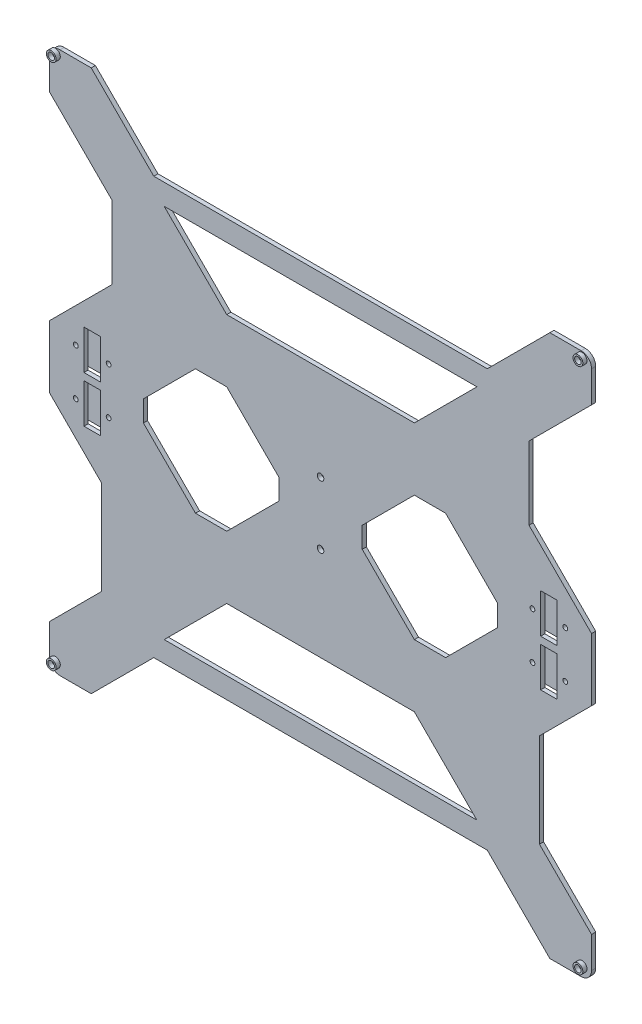
from build123d import *

# Parameters (mm, degrees)
MODEL_R             = 1.4605
MODEL_R_2           = 2
BOSS_EXTRUDE1_DEPTH = 1.27
SKETCH1_W           = 10
SKETCH1_H           = 24
CUT_EXTRUDE1_DEPTH  = 10
SKETCH2_R           = 3
SKETCH2_R_2         = 2
BOSS_EXTRUDE2_DEPTH = 2.54
SKETCH3_W           = 20
SKETCH3_H           = 20
SKETCH3_W_2         = 21.97233685
SKETCH3_H_2         = 68.295186165
BOSS_EXTRUDE3_DEPTH = 1


with BuildPart() as part:
    # Model → Boss-Extrude1 (new, symmetric)
    with BuildSketch(Plane.XY):
        with BuildLine():
            Line((-290.681304326, 108.4317), (-252.581304326, 70.3317))
            Line((-252.581304326, 70.3317), (-252.581304326, 25.8817))
            Line((-252.581304326, 25.8817), (-290.681304326, -12.2183))
            Line((-290.681304326, -12.2183), (-290.681304326, -50.3183))
            Line((-290.681304326, -50.3183), (-258.931304326, -82.0683))
            Line((-258.931304326, -82.0683), (-258.931304326, -139.2183))
            Line((-258.931304326, -139.2183), (-290.681304326, -170.9683))
            Line((-290.681304326, -170.9683), (-290.681304326, -190.0183))
            ThreePointArc((-290.681304326, -190.0183), (-288.821432386, -194.508428061), (-284.331304326, -196.3683))
            Line((-284.331304326, -196.3683), (-265.281304326, -196.3683))
            Line((-265.281304326, -196.3683), (-227.181304326, -158.2683))
            Line((-227.181304326, -158.2683), (-23.981304326, -158.2683))
            Line((-23.981304326, -158.2683), (14.118695674, -196.3683))
            Line((14.118695674, -196.3683), (33.168695674, -196.3683))
            ThreePointArc((33.168695674, -196.3683), (37.658823735, -194.508428061), (39.518695674, -190.0183))
            Line((39.518695674, -190.0183), (39.518695674, -170.9683))
            Line((39.518695674, -170.9683), (7.768695674, -139.2183))
            Line((7.768695674, -139.2183), (7.768695674, -82.0683))
            Line((7.768695674, -82.0683), (22.457936385, -67.37905929))
            Line((22.457936385, -67.37905929), (39.518695674, -50.3183))
            Line((39.518695674, -50.3183), (39.518695674, -12.2183))
            Line((39.518695674, -12.2183), (1.418695674, 25.8817))
            Line((1.418695674, 25.8817), (1.418695674, 70.3317))
            Line((1.418695674, 70.3317), (39.518695674, 108.4317))
            Line((39.518695674, 108.4317), (39.518695674, 127.4817))
            ThreePointArc((39.518695674, 127.4817), (37.658823735, 131.971828061), (33.168695674, 133.8317))
            Line((33.168695674, 133.8317), (14.118695674, 133.8317))
            Line((14.118695674, 133.8317), (-23.981304326, 95.7317))
            Line((-23.981304326, 95.7317), (-227.181304326, 95.7317))
            Line((-227.181304326, 95.7317), (-265.281304326, 133.8317))
            Line((-265.281304326, 133.8317), (-284.331304326, 133.8317))
            ThreePointArc((-284.331304326, 133.8317), (-288.821432386, 131.971828061), (-290.681304326, 127.4817))
            Line((-290.681304326, 127.4817), (-290.681304326, 108.4317))
        make_face()
        with Locations((-287.125304326, -190.6025)):
            Circle(MODEL_R, mode=Mode.SUBTRACT)
        with Locations((-274.681304256, -45.4288)):
            Circle(MODEL_R, mode=Mode.SUBTRACT)
        with Locations((-254.681304256, -45.4288)):
            Circle(MODEL_R, mode=Mode.SUBTRACT)
        Polygon((-68.431304326, -107.4683), (-30.331304326, -145.5683), (-220.831304326, -145.5683), (-182.731304326, -107.4683), align=None, mode=Mode.SUBTRACT)
        with Locations((33.752895674, -190.6025)):
            Circle(MODEL_R, mode=Mode.SUBTRACT)
        with Locations((-125.581304326, -50.3183)):
            Circle(MODEL_R_2, mode=Mode.SUBTRACT)
        Polygon((-68.431304326, -69.3683), (-100.181304326, -37.6183), (-100.181304326, -24.9183), (-68.431304326, 6.8317), (-49.381304326, 6.8317), (-17.631304326, -24.9183), (-17.631304326, -37.6183), (-49.381304326, -69.3683), align=None, mode=Mode.SUBTRACT)
        with Locations((3.518695604, -45.4288)):
            Circle(MODEL_R, mode=Mode.SUBTRACT)
        with Locations((23.518695604, -45.4288)):
            Circle(MODEL_R, mode=Mode.SUBTRACT)
        with Locations((-274.681304256, -17.1078)):
            Circle(MODEL_R, mode=Mode.SUBTRACT)
        with Locations((-254.681304256, -17.1078)):
            Circle(MODEL_R, mode=Mode.SUBTRACT)
        Polygon((-182.731304326, -69.3683), (-201.781304326, -69.3683), (-233.531304326, -37.6183), (-233.531304326, -24.9183), (-201.781304326, 6.8317), (-182.731304326, 6.8317), (-150.981304326, -24.9183), (-150.981304326, -37.6183), align=None, mode=Mode.SUBTRACT)
        with Locations((-287.125304326, 130.2757)):
            Circle(MODEL_R, mode=Mode.SUBTRACT)
        with Locations((-125.581304326, -12.2183)):
            Circle(MODEL_R_2, mode=Mode.SUBTRACT)
        with Locations((3.518695604, -17.1078)):
            Circle(MODEL_R, mode=Mode.SUBTRACT)
        with Locations((23.518695604, -17.1078)):
            Circle(MODEL_R, mode=Mode.SUBTRACT)
        Polygon((-182.731304326, 44.9317), (-220.831304326, 83.0317), (-30.331304326, 83.0317), (-68.431304326, 44.9317), align=None, mode=Mode.SUBTRACT)
        with Locations((33.752895674, 130.2757)):
            Circle(MODEL_R, mode=Mode.SUBTRACT)
    extrude(amount=BOSS_EXTRUDE1_DEPTH, both=True)

    # Sketch1 → Cut-Extrude1 (cut)
    with BuildSketch(Plane.XY.offset(1.27)):
        with Locations((-264.681304256, -45.4288)):
            Rectangle(SKETCH1_W, SKETCH1_H)
        with Locations((-264.681304256, -17.1078)):
            Rectangle(SKETCH1_W, SKETCH1_H)
        with Locations((13.518695604, -17.1078)):
            Rectangle(SKETCH1_W, SKETCH1_H)
        with Locations((13.518695604, -45.4288)):
            Rectangle(SKETCH1_W, SKETCH1_H)
    extrude(amount=-CUT_EXTRUDE1_DEPTH, mode=Mode.SUBTRACT)

    # Sketch2 → Boss-Extrude2 (add)
    # profile 1 of 4: a face of its own
    with BuildSketch(Plane.XY.offset(1.27)):
        with Locations((33.752895674, -190.6025)):
            Circle(SKETCH2_R)
        with Locations((33.752895674, -190.6025)):
            Circle(SKETCH2_R_2, mode=Mode.SUBTRACT)
    # profile 2 of 4: a face of its own
    with BuildSketch(Plane.XY.offset(1.27)):
        with Locations((-287.125304326, -190.6025)):
            Circle(SKETCH2_R)
        with Locations((-287.125304326, -190.6025)):
            Circle(SKETCH2_R_2, mode=Mode.SUBTRACT)
    # profile 3 of 4: a face of its own
    with BuildSketch(Plane.XY.offset(1.27)):
        with Locations((-287.125304326, 130.2757)):
            Circle(SKETCH2_R)
        with Locations((-287.125304326, 130.2757)):
            Circle(SKETCH2_R_2, mode=Mode.SUBTRACT)
    # profile 4 of 4: a face of its own
    with BuildSketch(Plane.XY.offset(1.27)):
        with Locations((33.752895674, 130.2757)):
            Circle(SKETCH2_R)
        with Locations((33.752895674, 130.2757)):
            Circle(SKETCH2_R_2, mode=Mode.SUBTRACT)
    extrude(amount=BOSS_EXTRUDE2_DEPTH)

    # Sketch3 → Boss-Extrude3 (add)
    with BuildSketch(Plane(origin=(0, 0, -1.27), x_dir=(-1, 0, 0), z_dir=(0, 0, -1))):
        with Locations((264.681304256, -17.1078)):
            Rectangle(SKETCH3_W, SKETCH3_H)
        with Locations((264.681304256, -45.4288)):
            Rectangle(SKETCH3_W, SKETCH3_H)
        with Locations((124.01288563, -30.494322806)):
            Rectangle(SKETCH3_W_2, SKETCH3_H_2)
        with Locations((-13.518695604, -17.1078)):
            Rectangle(SKETCH3_W, SKETCH3_H)
        with Locations((-13.518695604, -45.4288)):
            Rectangle(SKETCH3_W, SKETCH3_H)
    extrude(amount=BOSS_EXTRUDE3_DEPTH)


solid = part.part
